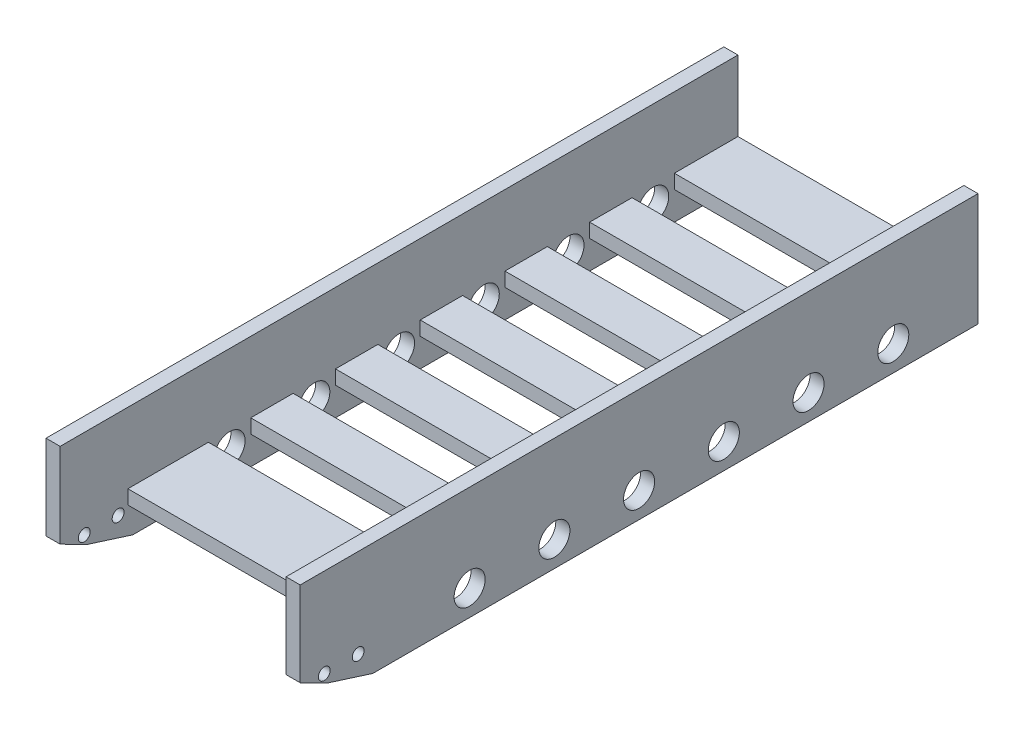
from build123d import *

# Parameters (mm, degrees)
SKETCH_1_W          = 5
SKETCH_1_H          = 10
EXTRUDE_1_DEPTH     = 240
SKETCH_3_R          = 2.1
SKETCH_3_R_2        = 5.5
CUT_EXTRUDE_1_DEPTH = 90
CUT_EXTRUDE_2_DEPTH = 80
SKETCH_8_W          = 24
SKETCH_8_H          = 5
CUT_EXTRUDE_3_DEPTH = 80


# Read off the part's stored shape, not the designer's step: 切除-拉伸2
with BuildPart() as part:
    # 草图1 → 凸台-拉伸1 (new body)
    with BuildSketch(Plane.XY):
        Polygon((0, -5), (0, 0), (-40, 0), (-40, 25), (-45, 25), (-45, -5), (-40, -5), align=None)
        Polygon((40, 25), (40, 0), (0, 0), (0, -5), (40, -5), (45, -5), (45, 25), align=None)
        with Locations((-42.5, -10)):
            Rectangle(SKETCH_1_W, SKETCH_1_H)
        with Locations((42.5, -10)):
            Rectangle(SKETCH_1_W, SKETCH_1_H)
    extrude(amount=EXTRUDE_1_DEPTH)

    # 草图3 → 切除-拉伸1 (cut, symmetric)
    with BuildSketch(Plane.ZY.offset(-40)):
        Polygon((240, -15), (240, -5), (230.53341221, -9.845037717), (214.283999291, -15), align=None)
        with Locations(Location((231.464466094, -6.464466094, 0), (0, 0, 90))):
            Circle(SKETCH_3_R)
        with Locations(Location((30, -6, 0), (0, 0, 90))):
            Circle(SKETCH_3_R_2)
        with Locations(Location((60, -6, 0), (0, 0, 90))):
            Circle(SKETCH_3_R_2)
        with Locations(Location((90, -6, 0), (0, 0, 90))):
            Circle(SKETCH_3_R_2)
        with Locations(Location((120, -6, 0), (0, 0, 90))):
            Circle(SKETCH_3_R_2)
        with Locations(Location((150, -6, 0), (0, 0, 90))):
            Circle(SKETCH_3_R_2)
        with Locations(Location((180, -6, 0), (0, 0, 90))):
            Circle(SKETCH_3_R_2)
        with Locations(Location((219.464466094, -6.464466094, 0), (0, 0, 90))):
            Circle(SKETCH_3_R)
    extrude(amount=CUT_EXTRUDE_1_DEPTH, both=True, mode=Mode.SUBTRACT)

    # 切除-拉伸2 outline → 切除-拉伸2 (cut)
    with BuildSketch(Plane(origin=(-40, 0, 0), x_dir=(0, 0, -1), z_dir=(1, 0, 0))):
        with BuildLine():
            Line((-82.5, -5), (-82.5, 0))
            Line((-82.5, 0), (-97.5, 0))
            Line((-97.5, 0), (-97.5, -5))
            Line((-97.5, -5), (-95.408326913, -5))
            ThreePointArc((-95.408326913, -5), (-90, -0.5), (-84.591673087, -5))
            Line((-84.591673087, -5), (-82.5, -5))
        make_face()
        with BuildLine():
            Line((-52.5, 0), (-67.5, 0))
            Line((-67.5, 0), (-67.5, -5))
            Line((-67.5, -5), (-65.408326913, -5))
            ThreePointArc((-65.408326913, -5), (-60, -0.5), (-54.591673087, -5))
            Line((-54.591673087, -5), (-52.5, -5))
            Line((-52.5, -5), (-52.5, 0))
        make_face()
        with BuildLine():
            Line((-112.5, -5), (-112.5, 0))
            Line((-112.5, 0), (-127.5, 0))
            Line((-127.5, 0), (-127.5, -5))
            Line((-127.5, -5), (-125.408326913, -5))
            ThreePointArc((-125.408326913, -5), (-120, -0.5), (-114.591673087, -5))
            Line((-114.591673087, -5), (-112.5, -5))
        make_face()
        with BuildLine():
            Line((-22.5, 0), (-37.5, 0))
            Line((-37.5, 0), (-37.5, -5))
            Line((-37.5, -5), (-35.408326913, -5))
            ThreePointArc((-35.408326913, -5), (-30, -0.5), (-24.591673087, -5))
            Line((-24.591673087, -5), (-22.5, -5))
            Line((-22.5, -5), (-22.5, 0))
        make_face()
        with BuildLine():
            Line((-142.5, -5), (-142.5, 0))
            Line((-142.5, 0), (-157.5, 0))
            Line((-157.5, 0), (-157.5, -5))
            Line((-157.5, -5), (-155.408326913, -5))
            ThreePointArc((-155.408326913, -5), (-150, -0.5), (-144.591673087, -5))
            Line((-144.591673087, -5), (-142.5, -5))
        make_face()
        with BuildLine():
            Line((-172.5, -5), (-172.5, 0))
            Line((-172.5, 0), (-187.5, 0))
            Line((-187.5, 0), (-187.5, -5))
            Line((-187.5, -5), (-185.408326913, -5))
            ThreePointArc((-185.408326913, -5), (-180, -0.5), (-174.591673087, -5))
            Line((-174.591673087, -5), (-172.5, -5))
        make_face()
    extrude(amount=CUT_EXTRUDE_2_DEPTH, mode=Mode.SUBTRACT)

    # 草图8 → 切除-拉伸3 (cut)
    with BuildSketch(Plane(origin=(-40, 0, 0), x_dir=(0, 0, -1), z_dir=(1, 0, 0))):
        with Locations((-228, -2.5)):
            Rectangle(SKETCH_8_W, SKETCH_8_H)
    extrude(amount=CUT_EXTRUDE_3_DEPTH, mode=Mode.SUBTRACT)


solid = part.part
